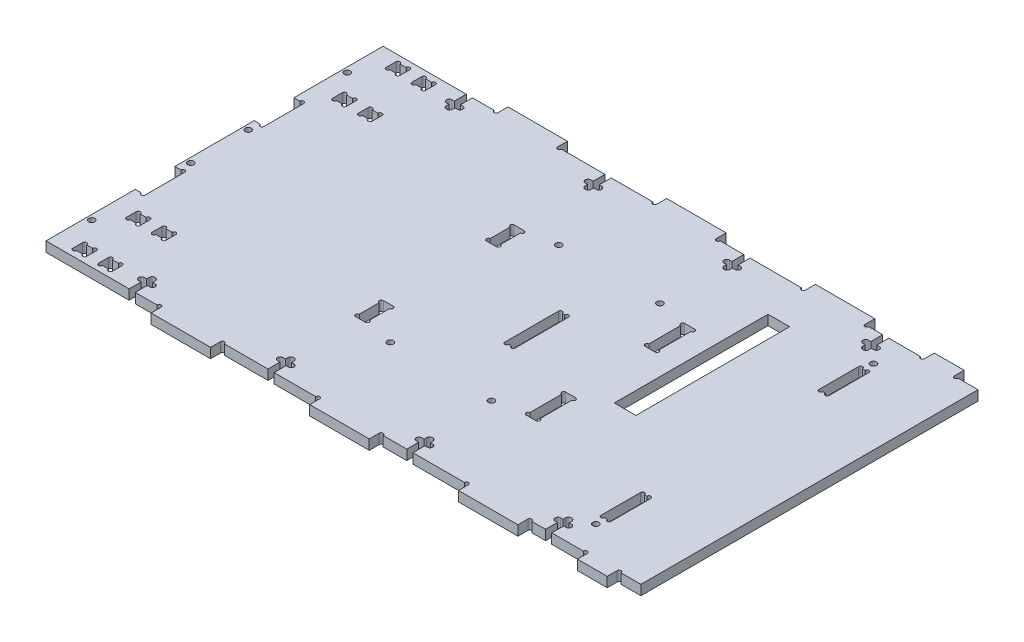
from build123d import *

# Parameters (mm, degrees)
SKETCH_1_W           = 300
SKETCH_1_H           = 170
EXTRUDE_1_DEPTH      = 5
SKETCH_2_W           = 5.2
SKETCH_2_H           = 27
SKETCH_2_H_2         = 20
CUT_EXTRUDE_1_DEPTH  = 10
SKETCH_3_R           = 1.55
CUT_EXTRUDE_2_DEPTH  = 10
SKETCH_4_W           = 5
SKETCH_4_H           = 20
CUT_EXTRUDE_3_DEPTH  = 5
SKETCH_5_R           = 1
CUT_EXTRUDE_4_DEPTH  = 10
SKETCH_8_W           = 30
SKETCH_8_H           = 5
SKETCH_8_W_2         = 15
EXTRUDE_2_DEPTH      = 5
SKETCH_9_R           = 1
CUT_EXTRUDE_6_DEPTH  = 5
SKETCH_13_W          = 7
SKETCH_13_H          = 5
CUT_EXTRUDE_9_DEPTH  = 10
SKETCH_14_R          = 1
CUT_EXTRUDE_10_DEPTH = 10
SKETCH_15_W          = 5
SKETCH_15_H          = 14
SKETCH_15_H_2        = 20
CUT_EXTRUDE_11_DEPTH = 10
SKETCH_16_R          = 1
CUT_EXTRUDE_12_DEPTH = 10
SKETCH_17_W          = 10.9
SKETCH_17_H          = 77.5
CUT_EXTRUDE_13_DEPTH = 10
CUT_EXTRUDE_5_DEPTH  = 10
SKETCH_18_R          = 6
CUT_EXTRUDE_14_DEPTH = 1.5
SKETCH_19_W          = 5.2
SKETCH_19_H          = 11.778826781
SKETCH_19_H_2        = 11.694797023
SKETCH_19_H_3        = 17.375654454
SKETCH_19_H_4        = 17.66182615
CUT_EXTRUDE_15_DEPTH = 10


with BuildPart() as part:
    # 스케치1 → 보스-돌출1 (new body)
    with BuildSketch(Plane(origin=(0, 0, 0), x_dir=(1, 0, 0), z_dir=(0, 1, 0))):
        with Locations((150, 85)):
            Rectangle(SKETCH_1_W, SKETCH_1_H)
    extrude(amount=EXTRUDE_1_DEPTH)

    # 스케치2 → 컷-돌출1 (cut)
    with BuildSketch(Plane.XZ):
        with Locations((162.5, -85)):
            Rectangle(SKETCH_2_W, SKETCH_2_H)
        with Locations((262.4, -30)):
            Rectangle(SKETCH_2_W, SKETCH_2_H_2)
        with Locations((262.4, -140)):
            Rectangle(SKETCH_2_W, SKETCH_2_H_2)
    extrude(amount=-CUT_EXTRUDE_1_DEPTH, mode=Mode.SUBTRACT)

    # 스케치3 → 컷-돌출2 (cut)
    with BuildSketch(Plane(origin=(0, 5, 0), x_dir=(1, 0, 0), z_dir=(0, 1, 0))):
        with Locations((131.1, 127.5)):
            Circle(SKETCH_3_R)
        with Locations((182.1, 127.5)):
            Circle(SKETCH_3_R)
        with Locations((182.1, 42.5)):
            Circle(SKETCH_3_R)
        with Locations((131.1, 42.5)):
            Circle(SKETCH_3_R)
        with Locations((2.5, 70.55)):
            Circle(SKETCH_3_R)
        with Locations((2.5, 20.55)):
            Circle(SKETCH_3_R)
        with Locations((2.5, 99.45)):
            Circle(SKETCH_3_R)
        with Locations((2.5, 149.45)):
            Circle(SKETCH_3_R)
        with Locations((262.3, 155)):
            Circle(SKETCH_3_R)
        with Locations((262.3, 15)):
            Circle(SKETCH_3_R)
    extrude(amount=-CUT_EXTRUDE_2_DEPTH, mode=Mode.SUBTRACT)

    # 스케치4 → 컷-돌출3 (cut)
    with BuildSketch(Plane.XZ):
        with Locations((2.5, -115)):
            Rectangle(SKETCH_4_W, SKETCH_4_H)
        with Locations((2.5, -55)):
            Rectangle(SKETCH_4_W, SKETCH_4_H)
    extrude(amount=-CUT_EXTRUDE_3_DEPTH, mode=Mode.SUBTRACT)

    # 스케치5 → 컷-돌출4 (cut)
    with BuildSketch(Plane.XZ):
        with Locations((4, -45)):
            Circle(SKETCH_5_R)
        with Locations((4, -65)):
            Circle(SKETCH_5_R)
        with Locations((4, -105)):
            Circle(SKETCH_5_R)
        with Locations((4, -125)):
            Circle(SKETCH_5_R)
        with Locations((164.1, -98.5)):
            Circle(SKETCH_5_R)
        with Locations((160.9, -98.5)):
            Circle(SKETCH_5_R)
        with Locations((164.1, -71.5)):
            Circle(SKETCH_5_R)
        with Locations((160.9, -71.5)):
            Circle(SKETCH_5_R)
        with Locations((264, -20)):
            Circle(SKETCH_5_R)
        with Locations((260.8, -20)):
            Circle(SKETCH_5_R)
        with Locations((264, -40)):
            Circle(SKETCH_5_R)
        with Locations((260.8, -40)):
            Circle(SKETCH_5_R)
        with Locations((264, -130)):
            Circle(SKETCH_5_R)
        with Locations((260.8, -130)):
            Circle(SKETCH_5_R)
        with Locations((264, -150)):
            Circle(SKETCH_5_R)
        with Locations((260.8, -150)):
            Circle(SKETCH_5_R)
    extrude(amount=-CUT_EXTRUDE_4_DEPTH, mode=Mode.SUBTRACT)

    # 스케치8 → 보스-돌출2 (add)
    with BuildSketch(Plane.XZ):
        with Locations((73, 2.5)):
            Rectangle(SKETCH_8_W, SKETCH_8_H)
        with Locations((153, 2.5)):
            Rectangle(SKETCH_8_W, SKETCH_8_H)
        with Locations((228, 2.5)):
            Rectangle(SKETCH_8_W, SKETCH_8_H)
        with Locations((280.5, 2.5)):
            Rectangle(SKETCH_8_W_2, SKETCH_8_H)
        with Locations((280.5, -172.5)):
            Rectangle(SKETCH_8_W_2, SKETCH_8_H)
        with Locations((228, -172.5)):
            Rectangle(SKETCH_8_W, SKETCH_8_H)
        with Locations((153, -172.5)):
            Rectangle(SKETCH_8_W, SKETCH_8_H)
        with Locations((73, -172.5)):
            Rectangle(SKETCH_8_W, SKETCH_8_H)
    extrude(amount=-EXTRUDE_2_DEPTH)

    # 스케치9 → 컷-돌출6 (cut)
    with BuildSketch(Plane.XZ):
        with Locations((57, 0)):
            Circle(SKETCH_9_R)
        with Locations((89, 0)):
            Circle(SKETCH_9_R)
        with Locations((137, 0)):
            Circle(SKETCH_9_R)
        with Locations((169, 0)):
            Circle(SKETCH_9_R)
        with Locations((212, 0)):
            Circle(SKETCH_9_R)
        with Locations((272, 0)):
            Circle(SKETCH_9_R)
        with Locations((244, 0)):
            Circle(SKETCH_9_R)
        with Locations((289, 0)):
            Circle(SKETCH_9_R)
        with Locations((289, -170)):
            Circle(SKETCH_9_R)
        with Locations((244, -170)):
            Circle(SKETCH_9_R)
        with Locations((272, -170)):
            Circle(SKETCH_9_R)
        with Locations((212, -170)):
            Circle(SKETCH_9_R)
        with Locations((169, -170)):
            Circle(SKETCH_9_R)
        with Locations((137, -170)):
            Circle(SKETCH_9_R)
        with Locations((89, -170)):
            Circle(SKETCH_9_R)
        with Locations((57, -170)):
            Circle(SKETCH_9_R)
    extrude(amount=-CUT_EXTRUDE_6_DEPTH, mode=Mode.SUBTRACT)

    # 스케치13 → 컷-돌출9 (cut)
    with BuildSketch(Plane(origin=(0, 5, 0), x_dir=(1, 0, 0), z_dir=(0, 1, 0))):
        with Locations((26.5, 6.000000001)):
            Rectangle(SKETCH_13_W, SKETCH_13_H)
        with Locations((13.5, 6.000000001)):
            Rectangle(SKETCH_13_W, SKETCH_13_H)
        with Locations((13.5, 33.000000001)):
            Rectangle(SKETCH_13_W, SKETCH_13_H)
        with Locations((26.5, 33.000000001)):
            Rectangle(SKETCH_13_W, SKETCH_13_H)
        with Locations((26.5, 136.999999999)):
            Rectangle(SKETCH_13_W, SKETCH_13_H)
        with Locations((13.5, 136.999999999)):
            Rectangle(SKETCH_13_W, SKETCH_13_H)
        with Locations((13.5, 163.999999999)):
            Rectangle(SKETCH_13_W, SKETCH_13_H)
        with Locations((26.5, 163.999999999)):
            Rectangle(SKETCH_13_W, SKETCH_13_H)
    extrude(amount=-CUT_EXTRUDE_9_DEPTH, mode=Mode.SUBTRACT)

    # 스케치14 → 컷-돌출10 (cut)
    with BuildSketch(Plane.XZ):
        with Locations((11, -8.500000001)):
            Circle(SKETCH_14_R)
        with Locations((11, -3.500000001)):
            Circle(SKETCH_14_R)
        with Locations((16, -3.500000001)):
            Circle(SKETCH_14_R)
        with Locations((16, -8.500000001)):
            Circle(SKETCH_14_R)
        with Locations((24, -8.500000001)):
            Circle(SKETCH_14_R)
        with Locations((24, -3.500000001)):
            Circle(SKETCH_14_R)
        with Locations((29, -3.500000001)):
            Circle(SKETCH_14_R)
        with Locations((29, -8.500000001)):
            Circle(SKETCH_14_R)
        with Locations((29, -30.500000001)):
            Circle(SKETCH_14_R)
        with Locations((29, -35.500000001)):
            Circle(SKETCH_14_R)
        with Locations((24, -35.500000001)):
            Circle(SKETCH_14_R)
        with Locations((24, -30.500000001)):
            Circle(SKETCH_14_R)
        with Locations((16, -30.500000001)):
            Circle(SKETCH_14_R)
        with Locations((16, -35.500000001)):
            Circle(SKETCH_14_R)
        with Locations((11, -35.500000001)):
            Circle(SKETCH_14_R)
        with Locations((11, -30.500000001)):
            Circle(SKETCH_14_R)
        with Locations((11, -139.499999999)):
            Circle(SKETCH_14_R)
        with Locations((11, -134.499999999)):
            Circle(SKETCH_14_R)
        with Locations((16, -134.499999999)):
            Circle(SKETCH_14_R)
        with Locations((16, -139.499999999)):
            Circle(SKETCH_14_R)
        with Locations((24, -139.499999999)):
            Circle(SKETCH_14_R)
        with Locations((24, -134.499999999)):
            Circle(SKETCH_14_R)
        with Locations((29, -134.499999999)):
            Circle(SKETCH_14_R)
        with Locations((29, -139.499999999)):
            Circle(SKETCH_14_R)
        with Locations((29, -161.499999999)):
            Circle(SKETCH_14_R)
        with Locations((29, -166.499999999)):
            Circle(SKETCH_14_R)
        with Locations((24, -166.499999999)):
            Circle(SKETCH_14_R)
        with Locations((24, -161.499999999)):
            Circle(SKETCH_14_R)
        with Locations((16, -161.499999999)):
            Circle(SKETCH_14_R)
        with Locations((16, -166.499999999)):
            Circle(SKETCH_14_R)
        with Locations((11, -166.499999999)):
            Circle(SKETCH_14_R)
        with Locations((11, -161.499999999)):
            Circle(SKETCH_14_R)
    extrude(amount=-CUT_EXTRUDE_10_DEPTH, mode=Mode.SUBTRACT)

    # 스케치15 → 컷-돌출11 (cut)
    with BuildSketch(Plane(origin=(0, 5, 0), x_dir=(1, 0, 0), z_dir=(0, 1, 0))):
        with Locations((113.6, 118)):
            Rectangle(SKETCH_15_W, SKETCH_15_H)
        with Locations((113.6, 52)):
            Rectangle(SKETCH_15_W, SKETCH_15_H)
        with Locations((199.6, 55)):
            Rectangle(SKETCH_15_W, SKETCH_15_H_2)
        with Locations((199.6, 115)):
            Rectangle(SKETCH_15_W, SKETCH_15_H_2)
    extrude(amount=-CUT_EXTRUDE_11_DEPTH, mode=Mode.SUBTRACT)

    # 스케치16 → 컷-돌출12 (cut)
    with BuildSketch(Plane(origin=(0, 5, 0), x_dir=(1, 0, 0), z_dir=(0, 1, 0))):
        with Locations((111.1, 46)):
            Circle(SKETCH_16_R)
        with Locations((116.1, 46)):
            Circle(SKETCH_16_R)
        with Locations((116.1, 58)):
            Circle(SKETCH_16_R)
        with Locations((111.1, 58)):
            Circle(SKETCH_16_R)
        with Locations((111.1, 112)):
            Circle(SKETCH_16_R)
        with Locations((116.1, 112)):
            Circle(SKETCH_16_R)
        with Locations((116.1, 124)):
            Circle(SKETCH_16_R)
        with Locations((111.1, 124)):
            Circle(SKETCH_16_R)
        with Locations((202.1, 124)):
            Circle(SKETCH_16_R)
        with Locations((197.1, 124)):
            Circle(SKETCH_16_R)
        with Locations((197.1, 64)):
            Circle(SKETCH_16_R)
        with Locations((202.1, 64)):
            Circle(SKETCH_16_R)
        with Locations((202.1, 106)):
            Circle(SKETCH_16_R)
        with Locations((197.1, 106)):
            Circle(SKETCH_16_R)
        with Locations((197.1, 46)):
            Circle(SKETCH_16_R)
        with Locations((202.1, 46)):
            Circle(SKETCH_16_R)
    extrude(amount=-CUT_EXTRUDE_12_DEPTH, mode=Mode.SUBTRACT)

    # 스케치17 → 컷-돌출13 (cut)
    with BuildSketch(Plane(origin=(0, 5, 0), x_dir=(1, 0, 0), z_dir=(0, 1, 0))):
        with Locations((219.55, 111.25)):
            Rectangle(SKETCH_17_W, SKETCH_17_H)
    extrude(amount=-CUT_EXTRUDE_13_DEPTH, mode=Mode.SUBTRACT)

    # 스케치7 → 컷-돌출5 (cut)
    with BuildSketch(Plane.XZ):
        with BuildLine():
            Line((115.028741621, -170), (111.928741621, -170))
            Line((111.928741621, -170), (111.928741621, -164))
            Line((111.928741621, -164), (110.728741621, -164))
            ThreePointArc((110.728741621, -164), (109.328741621, -162.6), (110.728741621, -161.2))
            Line((110.728741621, -161.2), (111.928741621, -161.2))
            Line((111.928741621, -161.2), (111.928741621, -160))
            ThreePointArc((111.928741621, -160), (113.478741621, -158.45), (115.028741621, -160))
            Line((115.028741621, -160), (115.028741621, -161.2))
            Line((115.028741621, -161.2), (116.228741621, -161.2))
            ThreePointArc((116.228741621, -161.2), (117.628741621, -162.6), (116.228741621, -164))
            Line((116.228741621, -164), (115.028741621, -164))
            Line((115.028741621, -164), (115.028741621, -170))
        make_face()
        with BuildLine():
            Line((185.028741621, -170), (181.928741621, -170))
            Line((181.928741621, -170), (181.928741621, -164))
            Line((181.928741621, -164), (180.728741621, -164))
            ThreePointArc((180.728741621, -164), (179.328741621, -162.6), (180.728741621, -161.2))
            Line((180.728741621, -161.2), (181.928741621, -161.2))
            Line((181.928741621, -161.2), (181.928741621, -160))
            ThreePointArc((181.928741621, -160), (183.478741621, -158.45), (185.028741621, -160))
            Line((185.028741621, -160), (185.028741621, -161.2))
            Line((185.028741621, -161.2), (186.228741621, -161.2))
            ThreePointArc((186.228741621, -161.2), (187.628741621, -162.6), (186.228741621, -164))
            Line((186.228741621, -164), (185.028741621, -164))
            Line((185.028741621, -164), (185.028741621, -170))
        make_face()
        with BuildLine():
            Line((255.028741621, -170), (251.928741621, -170))
            Line((251.928741621, -170), (251.928741621, -164))
            Line((251.928741621, -164), (250.728741621, -164))
            ThreePointArc((250.728741621, -164), (249.328741621, -162.6), (250.728741621, -161.2))
            Line((250.728741621, -161.2), (251.928741621, -161.2))
            Line((251.928741621, -161.2), (251.928741621, -160))
            ThreePointArc((251.928741621, -160), (253.478741621, -158.45), (255.028741621, -160))
            Line((255.028741621, -160), (255.028741621, -161.2))
            Line((255.028741621, -161.2), (256.228741621, -161.2))
            ThreePointArc((256.228741621, -161.2), (257.628741621, -162.6), (256.228741621, -164))
            Line((256.228741621, -164), (255.028741621, -164))
            Line((255.028741621, -164), (255.028741621, -170))
        make_face()
        with BuildLine():
            Line((46.228741621, -8.8), (45.028741621, -8.8))
            Line((45.028741621, -8.8), (45.028741621, -10))
            ThreePointArc((45.028741621, -10), (43.478741621, -11.55), (41.928741621, -10))
            Line((41.928741621, -10), (41.928741621, -8.8))
            Line((41.928741621, -8.8), (40.728741621, -8.8))
            ThreePointArc((40.728741621, -8.8), (39.328741621, -7.4), (40.728741621, -6))
            Line((40.728741621, -6), (41.928741621, -6))
            Line((41.928741621, -6), (41.928741621, 0))
            Line((41.928741621, 0), (45.028741621, 0))
            Line((45.028741621, 0), (45.028741621, -6))
            Line((45.028741621, -6), (46.228741621, -6))
            ThreePointArc((46.228741621, -6), (47.628741621, -7.4), (46.228741621, -8.8))
        make_face()
        with BuildLine():
            Line((45.028741621, -170), (41.928741621, -170))
            Line((41.928741621, -170), (41.928741621, -164))
            Line((41.928741621, -164), (40.728741621, -164))
            ThreePointArc((40.728741621, -164), (39.328741621, -162.6), (40.728741621, -161.2))
            Line((40.728741621, -161.2), (41.928741621, -161.2))
            Line((41.928741621, -161.2), (41.928741621, -160))
            ThreePointArc((41.928741621, -160), (43.478741621, -158.45), (45.028741621, -160))
            Line((45.028741621, -160), (45.028741621, -161.2))
            Line((45.028741621, -161.2), (46.228741621, -161.2))
            ThreePointArc((46.228741621, -161.2), (47.628741621, -162.6), (46.228741621, -164))
            Line((46.228741621, -164), (45.028741621, -164))
            Line((45.028741621, -164), (45.028741621, -170))
        make_face()
        with BuildLine():
            Line((256.228741621, -8.8), (255.028741621, -8.8))
            Line((255.028741621, -8.8), (255.028741621, -10))
            ThreePointArc((255.028741621, -10), (253.478741621, -11.55), (251.928741621, -10))
            Line((251.928741621, -10), (251.928741621, -8.8))
            Line((251.928741621, -8.8), (250.728741621, -8.8))
            ThreePointArc((250.728741621, -8.8), (249.328741621, -7.4), (250.728741621, -6))
            Line((250.728741621, -6), (251.928741621, -6))
            Line((251.928741621, -6), (251.928741621, 0))
            Line((251.928741621, 0), (255.028741621, 0))
            Line((255.028741621, 0), (255.028741621, -6))
            Line((255.028741621, -6), (256.228741621, -6))
            ThreePointArc((256.228741621, -6), (257.628741621, -7.4), (256.228741621, -8.8))
        make_face()
        with BuildLine():
            Line((186.228741621, -8.8), (185.028741621, -8.8))
            Line((185.028741621, -8.8), (185.028741621, -10))
            ThreePointArc((185.028741621, -10), (183.478741621, -11.55), (181.928741621, -10))
            Line((181.928741621, -10), (181.928741621, -8.8))
            Line((181.928741621, -8.8), (180.728741621, -8.8))
            ThreePointArc((180.728741621, -8.8), (179.328741621, -7.4), (180.728741621, -6))
            Line((180.728741621, -6), (181.928741621, -6))
            Line((181.928741621, -6), (181.928741621, 0))
            Line((181.928741621, 0), (185.028741621, 0))
            Line((185.028741621, 0), (185.028741621, -6))
            Line((185.028741621, -6), (186.228741621, -6))
            ThreePointArc((186.228741621, -6), (187.628741621, -7.4), (186.228741621, -8.8))
        make_face()
        with BuildLine():
            Line((116.228741621, -8.8), (115.028741621, -8.8))
            Line((115.028741621, -8.8), (115.028741621, -10))
            ThreePointArc((115.028741621, -10), (113.478741621, -11.55), (111.928741621, -10))
            Line((111.928741621, -10), (111.928741621, -8.8))
            Line((111.928741621, -8.8), (110.728741621, -8.8))
            ThreePointArc((110.728741621, -8.8), (109.328741621, -7.4), (110.728741621, -6))
            Line((110.728741621, -6), (111.928741621, -6))
            Line((111.928741621, -6), (111.928741621, 0))
            Line((111.928741621, 0), (115.028741621, 0))
            Line((115.028741621, 0), (115.028741621, -6))
            Line((115.028741621, -6), (116.228741621, -6))
            ThreePointArc((116.228741621, -6), (117.628741621, -7.4), (116.228741621, -8.8))
        make_face()
    extrude(amount=-CUT_EXTRUDE_5_DEPTH, mode=Mode.SUBTRACT)

    # 스케치18 → 컷-돌출14 (cut)
    with BuildSketch(Plane.XZ):
        with Locations((15, -17.5)):
            Circle(SKETCH_18_R)
        with Locations((15, -152.5)):
            Circle(SKETCH_18_R)
        with Locations((285, -17.5)):
            Circle(SKETCH_18_R)
        with Locations((285, -152.5)):
            Circle(SKETCH_18_R)
    extrude(amount=-CUT_EXTRUDE_14_DEPTH, mode=Mode.SUBTRACT)

    # 스케치19 → 컷-돌출15 (cut)
    with BuildSketch(Plane(origin=(0, 5, 0), x_dir=(1, 0, 0), z_dir=(0, 1, 0))):
        with Locations((113.6, 118.024605115)):
            Rectangle(SKETCH_19_W, SKETCH_19_H)
        with Locations((113.6, 52.140636728)):
            Rectangle(SKETCH_19_W, SKETCH_19_H_2)
        with Locations((199.6, 55.305919248)):
            Rectangle(SKETCH_19_W, SKETCH_19_H_3)
        with Locations((199.6, 115.08310543)):
            Rectangle(SKETCH_19_W, SKETCH_19_H_4)
    extrude(amount=-CUT_EXTRUDE_15_DEPTH, mode=Mode.SUBTRACT)


solid = part.part
